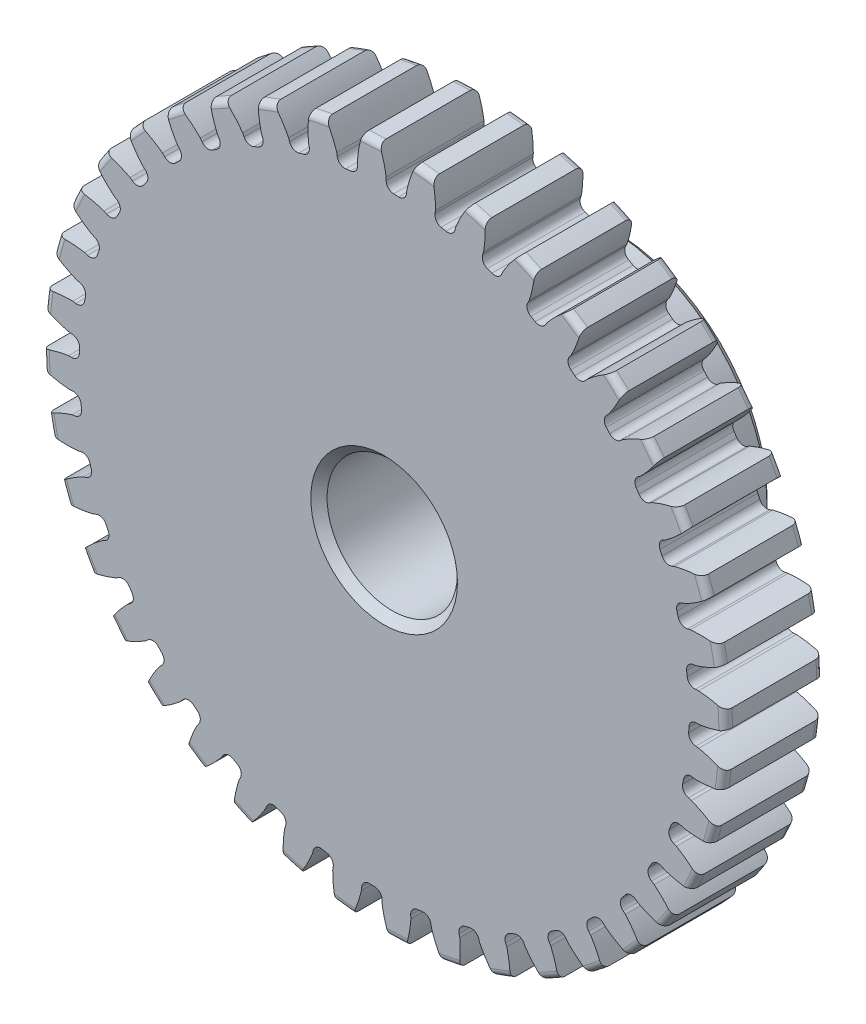
from build123d import *

# Parameters (mm, degrees)
SKETCH1_R                = 16.637
BOSS_EXTRUDE1_DEPTH      = 4.7625
SKETCH2_W                = 6.35
SKETCH2_H                = 7.9375
FILLET2_R                = 0.33274
CUT_EXTRUDE1_DEPTH       = 27.020514873
FILLET1_R                = 0.37404675
CIRPATTERN1_COUNT        = 40
FILLET1_OF_CIRPATTERN1_R = 0.37404675
SKETCH5_R                = 3.175
CUT_EXTRUDE2_DEPTH       = 27.018247706
CHAMFER1_SIZE            = 0.396875


with BuildPart() as part:
    # Sketch1 → Boss-Extrude1 (new body)
    with BuildSketch(Plane.XY):
        Circle(SKETCH1_R)
    extrude(amount=-BOSS_EXTRUDE1_DEPTH)

    # Sketch2 → Revolve1 (revolve)
    with BuildSketch(Plane(origin=(0, 0, 0), x_dir=(0, 0, -1), z_dir=(1, 0, 0))):
        with Locations((7.9375, 3.96875)):
            Rectangle(SKETCH2_W, SKETCH2_H)
    revolve(axis=Axis((0, 0, -4.7625), (0, 0, -1)))

    # Fillet2
    fillet2_edges = [part.edges().sort_by_distance(p)[0] for p in [
        (-16.637, 0, -4.7625),
        (-16.637, 0, 0),
        (0, -7.9375, -4.7625),
    ]]
    fillet(fillet2_edges, radius=FILLET2_R)

    # Sketch4 → Cut-Extrude1 (cut, through all)
    with BuildSketch(Plane.XY):
        with BuildLine():
            Line((0.099855881, 15.369019402), (0.099855881, 14.85072679))
            ThreePointArc((0.099855881, 14.85072679), (0.58305134, 14.839612815), (1.065629257, 14.812781362))
            Line((1.065629257, 14.812781362), (1.106294121, 15.329476243))
            add(Edge.make_bspline(
                [(3.036161866, 18.483177992), (1.529837457, 17.142178464), (1.106294121, 15.329476243)],
                knots=[0, 0, 0, 1, 1, 1], degree=2))
            ThreePointArc((3.036161866, 18.483177992), (0.735372912, 18.716446624), (-1.576625532, 18.664415327))
            add(Edge.make_bspline(
                [(-1.576625532, 18.664415327), (-0.180158497, 17.209364545), (0.099855881, 15.369019402)],
                knots=[0, 0, 0, 1, 1, 1], degree=2))
        make_face()
    cut_extrude1 = extrude(amount=-CUT_EXTRUDE1_DEPTH, mode=Mode.SUBTRACT)

    # Fillet1
    fillet1_edges = [part.edges().sort_by_distance(p)[0] for p in [
        (1.065629257, 14.812781362, -2.38125),
        (0.099855881, 14.85072679, -2.38125),
    ]]
    fillet(fillet1_edges, radius=FILLET1_R)

    # CirPattern1: Cut-Extrude1 ×40 about axis
    cirpattern1_axis = Axis((0, 0, -4.7625), (0, 0, 1))
    for i in range(1, CIRPATTERN1_COUNT):
        add(cut_extrude1.rotate(cirpattern1_axis, i * 360 / CIRPATTERN1_COUNT), mode=Mode.SUBTRACT)

    # Fillet1 of CirPattern1
    fillet1_of_cirpattern1_edges = [part.edges().sort_by_distance(p)[0] for p in [
        (-1.264719936, 14.797112585, -2.38125),
        (-2.224539012, 14.683510601, -2.38125),
        (-3.563927526, 14.417089788, -2.38125),
        (-4.494158371, 14.154737649, -2.38125),
        (-5.775379393, 13.682070393, -2.38125),
        (-6.653116636, 13.27742808, -2.38125),
        (-7.844622251, 12.610153017, -2.38125),
        (-8.648253088, 12.073184166, -2.38125),
        (-9.720704475, 11.227731823, -2.38125),
        (-10.430440848, 10.571658389, -2.38125),
        (-11.357430694, 9.568846608, -2.38125),
        (-11.955796538, 8.809823297, -2.38125),
        (-12.714499276, 7.674344633, -2.38125),
        (-13.186760837, 6.831061118, -2.38125),
        (-13.758494688, 5.590874823, -2.38125),
        (-14.093023321, 4.684095543, -2.38125),
        (-14.4637103, 3.369739121, -2.38125),
        (-14.652268798, 2.42179199, -2.38125),
        (-14.812781362, 1.065629257, -2.38125),
        (-14.85072679, 0.099855881, -2.38125),
        (-14.797112585, -1.264719936, -2.38125),
        (-14.683510601, -2.224539012, -2.38125),
        (-14.417089788, -3.563927526, -2.38125),
        (-14.154737649, -4.494158371, -2.38125),
        (-13.682070393, -5.775379393, -2.38125),
        (-13.27742808, -6.653116636, -2.38125),
        (-12.610153017, -7.844622251, -2.38125),
        (-12.073184166, -8.648253088, -2.38125),
        (-11.227731823, -9.720704475, -2.38125),
        (-10.571658389, -10.430440848, -2.38125),
        (-9.568846608, -11.357430694, -2.38125),
        (-8.809823297, -11.955796538, -2.38125),
        (-7.674344633, -12.714499276, -2.38125),
        (-6.831061118, -13.186760837, -2.38125),
        (-5.590874823, -13.758494688, -2.38125),
        (-4.684095543, -14.093023321, -2.38125),
        (-3.369739121, -14.4637103, -2.38125),
        (-2.42179199, -14.652268798, -2.38125),
        (-1.065629257, -14.812781362, -2.38125),
        (-0.099855881, -14.85072679, -2.38125),
        (1.264719936, -14.797112585, -2.38125),
        (2.224539012, -14.683510601, -2.38125),
        (3.563927526, -14.417089788, -2.38125),
        (4.494158371, -14.154737649, -2.38125),
        (5.775379393, -13.682070393, -2.38125),
        (6.653116636, -13.27742808, -2.38125),
        (7.844622251, -12.610153017, -2.38125),
        (8.648253088, -12.073184166, -2.38125),
        (9.720704475, -11.227731823, -2.38125),
        (10.430440848, -10.571658389, -2.38125),
        (11.357430694, -9.568846608, -2.38125),
        (11.955796538, -8.809823297, -2.38125),
        (12.714499276, -7.674344633, -2.38125),
        (13.186760837, -6.831061118, -2.38125),
        (13.758494688, -5.590874823, -2.38125),
        (14.093023321, -4.684095543, -2.38125),
        (14.4637103, -3.369739121, -2.38125),
        (14.652268798, -2.42179199, -2.38125),
        (14.812781362, -1.065629257, -2.38125),
        (14.85072679, -0.099855881, -2.38125),
        (14.797112585, 1.264719936, -2.38125),
        (14.683510601, 2.224539012, -2.38125),
        (14.417089788, 3.563927526, -2.38125),
        (14.154737649, 4.494158371, -2.38125),
        (13.682070393, 5.775379393, -2.38125),
        (13.27742808, 6.653116636, -2.38125),
        (12.610153017, 7.844622251, -2.38125),
        (12.073184166, 8.648253088, -2.38125),
        (11.227731823, 9.720704475, -2.38125),
        (10.571658389, 10.430440848, -2.38125),
        (9.568846608, 11.357430694, -2.38125),
        (8.809823297, 11.955796538, -2.38125),
        (7.674344633, 12.714499276, -2.38125),
        (6.831061118, 13.186760837, -2.38125),
        (5.590874823, 13.758494688, -2.38125),
        (4.684095543, 14.093023321, -2.38125),
        (3.369739121, 14.4637103, -2.38125),
        (2.42179199, 14.652268798, -2.38125),
    ]]
    fillet(fillet1_of_cirpattern1_edges, radius=FILLET1_OF_CIRPATTERN1_R)

    # Sketch5 → Cut-Extrude2 (cut, through all)
    with BuildSketch(Plane.XY):
        Circle(SKETCH5_R)
    extrude(amount=-CUT_EXTRUDE2_DEPTH, mode=Mode.SUBTRACT)

    # Chamfer1
    chamfer1_edges = [part.edges().sort_by_distance(p)[0] for p in [
        (0, -7.9375, -11.1125),
        (-3.175, 0, 0),
        (-3.175, 0, -11.1125),
    ]]
    chamfer(chamfer1_edges, length=CHAMFER1_SIZE)


solid = part.part
